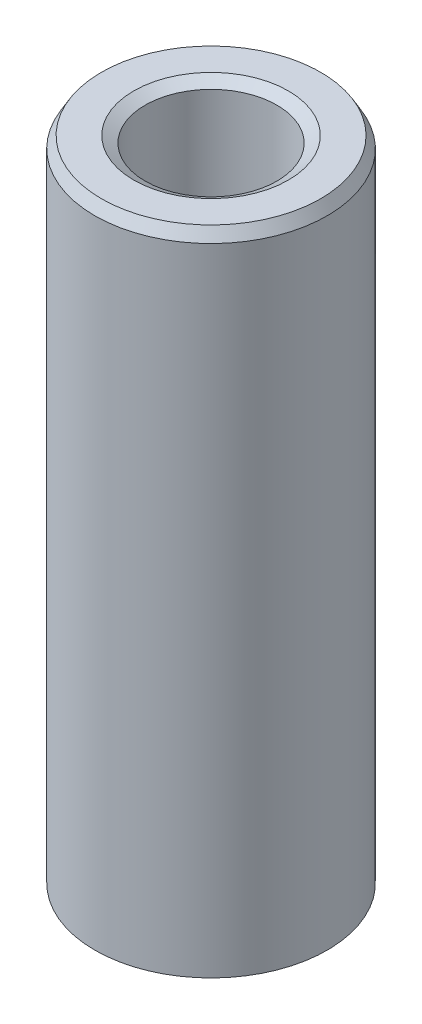
from build123d import *
from OCP.BRepFilletAPI import BRepFilletAPI_MakeChamfer

# Parameters (mm, degrees)
SKETCH1_R           = 25
BOSS_EXTRUDE1_DEPTH = 140.711096177
SKETCH2_R           = 14.171797432
CUT_EXTRUDE1_DEPTH  = 146.084846167
CHAMFER1_SIZE       = 2.459659491
CHAMFER1_SIZE2      = 1.420085069


with BuildPart() as part:
    # Sketch1 → Boss-Extrude1 (new body)
    with BuildSketch(Plane(origin=(0, 0, 0), x_dir=(1, 0, 0), z_dir=(0, 1, 0))):
        Circle(SKETCH1_R)
    extrude(amount=BOSS_EXTRUDE1_DEPTH)

    # Sketch2 → Cut-Extrude1 (cut, through all)
    with BuildSketch(Plane(origin=(0, 0, 0), x_dir=(1, 0, 0), z_dir=(0, 1, 0))):
        Circle(SKETCH2_R)
    extrude(amount=CUT_EXTRUDE1_DEPTH, mode=Mode.SUBTRACT)

    # Chamfer1: one chamfer whose edges measure the first distance from different faces: ONE call of the kernel's chamfer builder (chamfer() names one face for all edges)
    chamfer1_edges_1 = [part.edges().sort_by_distance(p)[0] for p in [
        (-14.171797432, 140.711096177, 0),
    ]]
    chamfer1_side_1 = [part.faces().sort_by_distance(p)[0] for p in [
        (-24.292893219, 140.711096177, 0),
    ]]
    chamfer1_edges_2 = [part.edges().sort_by_distance(p)[0] for p in [
        (-14.171797432, 0, 0),
    ]]
    chamfer1_side_2 = [part.faces().sort_by_distance(p)[0] for p in [
        (-14.171797432, 70.355548089, 0),
    ]]
    chamfer1_edges_3 = [part.edges().sort_by_distance(p)[0] for p in [
        (-25, 0, 0),
    ]]
    chamfer1_side_3 = [part.faces().sort_by_distance(p)[0] for p in [
        (-24.292893219, 0, 0),
    ]]
    chamfer1_edges_4 = [part.edges().sort_by_distance(p)[0] for p in [
        (-25, 140.711096177, 0),
    ]]
    chamfer1_side_4 = [part.faces().sort_by_distance(p)[0] for p in [
        (-25, 70.355548089, 0),
    ]]
    chamfer1 = BRepFilletAPI_MakeChamfer(part.part.solid().wrapped)
    for e in chamfer1_edges_1:
        chamfer1.Add(CHAMFER1_SIZE, CHAMFER1_SIZE2, e.wrapped, chamfer1_side_1[0].wrapped)  # the first distance lies on this face
    for e in chamfer1_edges_2:
        chamfer1.Add(CHAMFER1_SIZE, CHAMFER1_SIZE2, e.wrapped, chamfer1_side_2[0].wrapped)  # the first distance lies on this face
    for e in chamfer1_edges_3:
        chamfer1.Add(CHAMFER1_SIZE, CHAMFER1_SIZE2, e.wrapped, chamfer1_side_3[0].wrapped)  # the first distance lies on this face
    for e in chamfer1_edges_4:
        chamfer1.Add(CHAMFER1_SIZE, CHAMFER1_SIZE2, e.wrapped, chamfer1_side_4[0].wrapped)  # the first distance lies on this face
    add(Compound.cast(chamfer1.Shape()), mode=Mode.REPLACE)


solid = part.part
